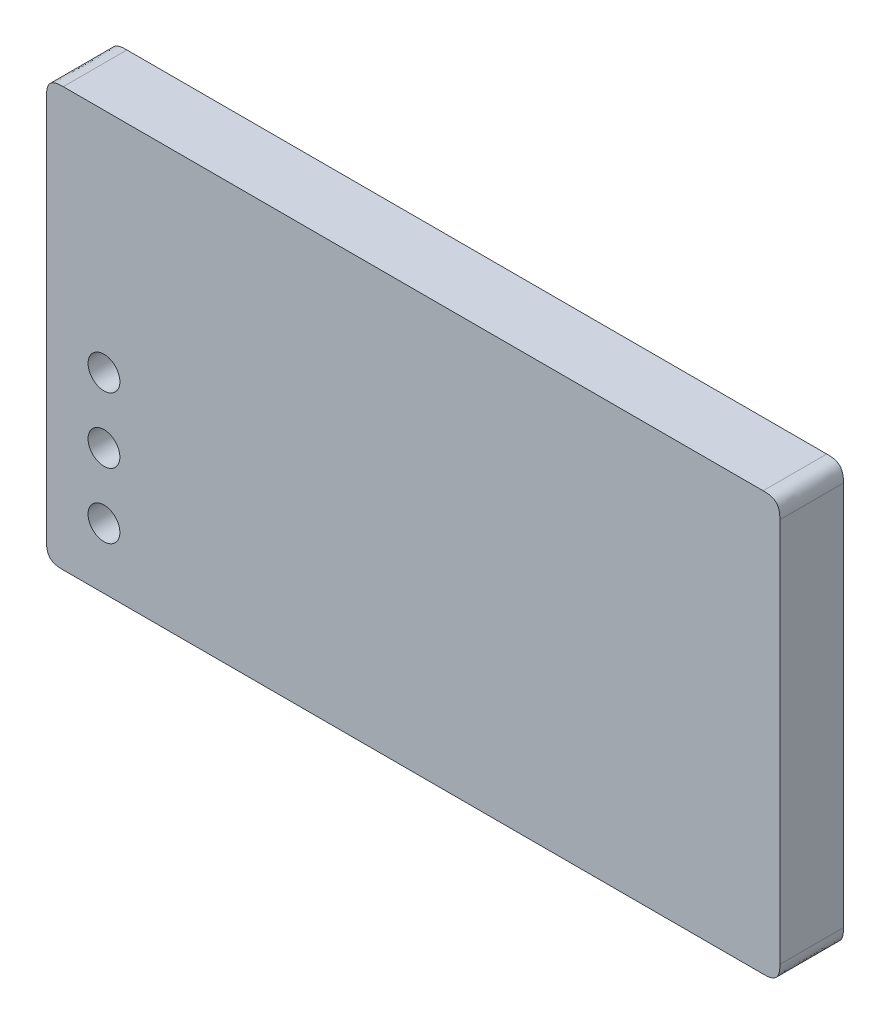
from build123d import *

# Parameters (mm, degrees)
ESQUISSE1_W             = 219
ESQUISSE1_H             = 125
BOSS_EXTRU_1_DEPTH      = 19
ESQUISSE3_W             = 213.8
ESQUISSE3_H             = 119.8
ENL_V_MAT_EXTRU_1_DEPTH = 7.7
ESQUISSE4_R             = 4.75
ENL_V_MAT_EXTRU_2_DEPTH = 253.87744067
CONG_4_SIZE             = 5
CONG_5_SIZE             = 5


with BuildPart() as part:
    # Esquisse1 → Boss.-Extru.1 (new body)
    with BuildSketch(Plane.XY):
        with Locations((109.5, 62.5)):
            Rectangle(ESQUISSE1_W, ESQUISSE1_H)
    extrude(amount=BOSS_EXTRU_1_DEPTH)

    # Esquisse3 → Enlèv. mat.-Extru.1 (cut)
    with BuildSketch(Plane(origin=(0, 0, 0), x_dir=(-1, 0, 0), z_dir=(0, 0, -1))):
        with Locations((-109.5, 62.5)):
            Rectangle(ESQUISSE3_W, ESQUISSE3_H)
    extrude(amount=-ENL_V_MAT_EXTRU_1_DEPTH, mode=Mode.SUBTRACT)

    # Esquisse4 → Enlèv. mat.-Extru.2 (cut, through all)
    with BuildSketch(Plane.XY.offset(19)):
        with Locations((17.15, 57.15)):
            Circle(ESQUISSE4_R)
        with Locations((17.15, 37.65)):
            Circle(ESQUISSE4_R)
        with Locations((17.15, 18.15)):
            Circle(ESQUISSE4_R)
    extrude(amount=-ENL_V_MAT_EXTRU_2_DEPTH, mode=Mode.SUBTRACT)

    # Congé4
    # a fillet whose section is not a circle: 5 mm, written as the material it takes off along each edge
    with BuildSketch(Plane(origin=(219, 0, -12.5), x_dir=(-1, 0, 0), z_dir=(0, 0, 1))) as cong_4_piece_1:
        with BuildLine():
            add(Edge.make_bspline([(CONG_4_SIZE, 0), (CONG_4_SIZE * 0.831801948466, 0), (CONG_4_SIZE * 0.663603896932, 0), (CONG_4_SIZE * 0.292893218813, -CONG_4_SIZE * 0.0716919198361), (CONG_4_SIZE * 0.0716919198361, -CONG_4_SIZE * 0.292893218813), (0, -CONG_4_SIZE * 0.663603896932), (0, -CONG_4_SIZE * 0.831801948466), (0, -CONG_4_SIZE)], knots=[0, 0, 0, 0, 0, 0, 0.5, 0.5, 1, 1, 1, 1, 1, 1], degree=5))
            Line((0, -CONG_4_SIZE), (0, 0))
            Line((0, 0), (CONG_4_SIZE, 0))
        make_face()
    extrude(amount=44, mode=Mode.SUBTRACT)

    # Congé5
    # a fillet whose section is not a circle: 5 mm, written as the material it takes off along each edge
    with BuildSketch(Plane(origin=(0, 125, -12.5), x_dir=(0, -1, 0), z_dir=(0, 0, 1)), Plane(origin=(0, 0, -12.5), x_dir=(1, 0, 0), z_dir=(0, 0, 1)), Plane(origin=(219, 125, -12.5), x_dir=(-1, 0, 0), z_dir=(0, 0, 1))) as cong_5_piece_1:
        with BuildLine():
            add(Edge.make_bspline([(CONG_5_SIZE, 0), (CONG_5_SIZE * 0.831801948466, 0), (CONG_5_SIZE * 0.663603896932, 0), (CONG_5_SIZE * 0.292893218813, CONG_5_SIZE * 0.0716919198361), (CONG_5_SIZE * 0.0716919198361, CONG_5_SIZE * 0.292893218813), (0, CONG_5_SIZE * 0.663603896932), (0, CONG_5_SIZE * 0.831801948466), (0, CONG_5_SIZE)], knots=[0, 0, 0, 0, 0, 0, 0.5, 0.5, 1, 1, 1, 1, 1, 1], degree=5))
            Line((0, CONG_5_SIZE), (0, 0))
            Line((0, 0), (CONG_5_SIZE, 0))
        make_face()
    extrude(amount=44, mode=Mode.SUBTRACT)


solid = part.part
